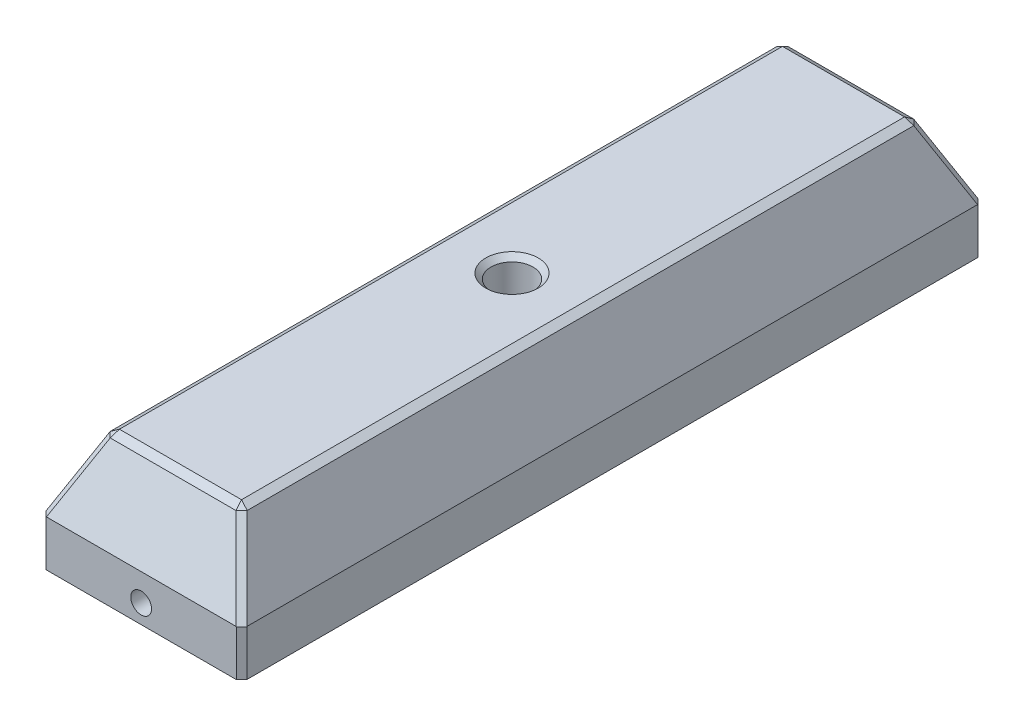
from build123d import *

# Parameters (mm, degrees)
EXTRUDE_1_DEPTH     = 71
CUT_EXTRUDE_1_DEPTH = 75.103710772
SKETCH_3_W          = 18.218739558
SKETCH_3_H          = 4.354088086
EXTRUDE_3_DEPTH     = 15.5
SKETCH_4_R          = 0.995
CUT_EXTRUDE_2_DEPTH = 12
SKETCH_5_W          = 4
SKETCH_5_H          = 3.5
SKETCH_6_R          = 1.5
CUT_EXTRUDE_3_DEPTH = 73.548604312
SKETCH_7_R          = 2.01
CUT_EXTRUDE_4_DEPTH = 5
CHAMFER_2_SIZE      = 0.5


with BuildPart() as part:
    # ｽｹｯﾁ1 → ﾎﾞｽ - 押し出し1 (new body)
    with BuildSketch(Plane.XY):
        Polygon((-6.990630221, 0), (-3.009369779, 0), (-1.990630221, -2.4), (1.990630221, -2.4), (3.009369779, 0), (6.990630221, 0), (8.009369779, -2.4), (9.609369779, -2.4), (9.609369779, 2), (6.345216172, 9), (-6.345216172, 9), (-9.609369779, 2), (-9.609369779, -2.4), (-8.009369779, -2.4), align=None)
    extrude(amount=EXTRUDE_1_DEPTH)

    # ｽｹｯﾁ2 → ｶｯﾄ - 押し出し1 (cut, through all)
    with BuildSketch(Plane(origin=(9.609369779, 0, 0), x_dir=(0, 0, -1), z_dir=(1, 0, 0))):
        Polygon((-71, 2), (-67.735846393, 9), (-71, 9), align=None)
        Polygon((-3.264153607, 9), (0, 9), (0, 2), align=None)
    extrude(amount=-CUT_EXTRUDE_1_DEPTH, mode=Mode.SUBTRACT)

    # 面取り1
    # the kernel refuses this chamfer: 0.5 mm, written as the material it takes off along each edge
    with BuildSketch(Plane(origin=(-6.138482875, 8.697897404, 3.470886905), x_dir=(0.1959067162203001, 0.5268881046463136, 0.8270486586180973), z_dir=(-0.41632572739388224, 0.8082980746110386, -0.4163257273938792)), Plane(origin=(6.138482875, 8.697897404, 3.470886905), x_dir=(-0.8270486586180952, 0.5268881046463165, 0.19590671622030123), z_dir=(0.4163257273938833, 0.8082980746110385, -0.41632572739387846))) as chamfer_1_piece_1:
        Polygon((-0.400884159, 0.228990916), (0.459173014, 0.228990916), (-0.058288855, -0.457981831), align=None)
    extrude(amount=0.4579583, mode=Mode.SUBTRACT)
    with BuildSketch(Plane(origin=(-6.138482875, 8.697897404, 67.529113095), x_dir=(-0.19590671622031064, -0.5268881046463169, 0.8270486586180926), z_dir=(-0.416325727393884, 0.808298074611038, 0.41632572739387863))) as chamfer_1_piece_2:
        Polygon((-0.459173014, 0.228990916), (0.400884159, 0.228990916), (0.058288855, -0.457981831), align=None)
    extrude(amount=0.4579583, mode=Mode.SUBTRACT)
    with BuildSketch(Plane(origin=(6.138482875, 8.697897404, 67.529113095), x_dir=(-0.8270486586180955, 0.5268881046463167, -0.19590671622029923), z_dir=(0.4163257273938827, 0.8082980746110371, 0.4163257273938819))) as chamfer_1_piece_3:
        Polygon((-0.400884159, -0.228990916), (0.459173014, -0.228990916), (-0.058288855, 0.457981831), align=None)
    extrude(amount=0.4579583, mode=Mode.SUBTRACT)
    with BuildSketch(Plane(origin=(9.609369779, -3.685841494, 71), x_dir=(-0.999621916911297, 0, 0.0274958766105822), z_dir=(0, 1, 0)), Plane(origin=(-9.609369779, 3.285841494, 71), x_dir=(0.999621916911297, 0, 0.0274958766105822), z_dir=(0, -1, 0))) as chamfer_1_piece_4:
        with BuildLine():
            Line((0.514336598, 0), (-0.028273577, -0.513558897))
            Line((-0.028273577, -0.513558897), (-0.038269797, -0.513283938))
            ThreePointArc((-0.038269797, -0.513283938), (-0.017064614, -0.256698915), (-0.009996219, 0.000274959))
            Line((-0.009996219, 0.000274959), (0.000274959, 0.009996219))
            ThreePointArc((0.000274959, 0.009996219), (0.257248832, 0.002927825), (0.514611556, 0.009996219))
            Line((0.514611556, 0.009996219), (0.514336598, 0))
        make_face()
    extrude(amount=6.971682988, mode=Mode.SUBTRACT)
    with BuildSketch(Plane(origin=(-9.609369779, 3.285841494, 0), x_dir=(0.9996219169112968, 0, -0.02749587661058639), z_dir=(0, -1, 0)), Plane(origin=(9.609369779, -3.685841494, 0), x_dir=(-0.9996219169112968, 0, -0.02749587661058639), z_dir=(0, 1, 0))) as chamfer_1_piece_5:
        with BuildLine():
            Line((0.514336598, 0), (-0.028273577, 0.513558897))
            Line((-0.028273577, 0.513558897), (-0.038269797, 0.513283938))
            ThreePointArc((-0.038269797, 0.513283938), (-0.017064614, 0.256698915), (-0.009996219, -0.000274959))
            Line((-0.009996219, -0.000274959), (0.000274959, -0.009996219))
            ThreePointArc((0.000274959, -0.009996219), (0.257248832, -0.002927825), (0.514611556, -0.009996219))
            Line((0.514611556, -0.009996219), (0.514336598, 0))
        make_face()
    extrude(amount=6.971682988, mode=Mode.SUBTRACT)
    with BuildSketch(Plane(origin=(-6.345216172, 9, 1.971704795), x_dir=(-0.441365564598093, -0.897327386401979, 0), z_dir=(0, 0, 1))) as chamfer_1_piece_6:
        with BuildLine():
            Line((0.516979525, 0), (-0.237770334, 0.459056747))
            Line((-0.237770334, 0.459056747), (-0.246743608, 0.454643091))
            ThreePointArc((-0.246743608, 0.454643091), (-0.123037104, 0.227486173), (-0.008973274, -0.004413656))
            Line((-0.008973274, -0.004413656), (0.000207861, -0.009997839))
            ThreePointArc((0.000207861, -0.009997839), (0.25858594, -0.004626004), (0.517187386, -0.009997839))
            Line((0.517187386, -0.009997839), (0.516979525, 0))
        make_face()
    extrude(amount=67.056590409, mode=Mode.SUBTRACT)
    with BuildSketch(Plane(origin=(6.345216172, 9, 1.971704795), x_dir=(0.441365564598093, -0.897327386401979, 0), z_dir=(0, 0, 1))) as chamfer_1_piece_7:
        with BuildLine():
            Line((0.516979525, 0), (-0.237770334, -0.459056747))
            Line((-0.237770334, -0.459056747), (-0.246743608, -0.454643091))
            ThreePointArc((-0.246743608, -0.454643091), (-0.123037104, -0.227486173), (-0.008973274, 0.004413656))
            Line((-0.008973274, 0.004413656), (0.000207861, 0.009997839))
            ThreePointArc((0.000207861, 0.009997839), (0.25858594, 0.004626004), (0.517187386, 0.009997839))
            Line((0.517187386, 0.009997839), (0.516979525, 0))
        make_face()
    extrude(amount=67.056590409, mode=Mode.SUBTRACT)
    with BuildSketch(Plane(origin=(7.637664984, 9, 67.735846393), x_dir=(0, -0.8973273864019788, 0.441365564598093), z_dir=(-1, 0, 0))) as chamfer_1_piece_8:
        with BuildLine():
            Line((0.516979525, 0), (-0.237770334, -0.459056747))
            Line((-0.237770334, -0.459056747), (-0.246743608, -0.454643091))
            ThreePointArc((-0.246743608, -0.454643091), (-0.123037104, -0.227486173), (-0.008973274, 0.004413656))
            Line((-0.008973274, 0.004413656), (0.000207861, 0.009997839))
            ThreePointArc((0.000207861, 0.009997839), (0.25858594, 0.004626004), (0.517187386, 0.009997839))
            Line((0.517187386, 0.009997839), (0.516979525, 0))
        make_face()
    extrude(amount=15.275329968, mode=Mode.SUBTRACT)
    with BuildSketch(Plane(origin=(5.843517245, 10.075896822, 67.234147465), x_dir=(-0.9208340423276119, -0.34219239318368305, 0.1870000869994816), z_dir=(0.38928162063502697, -0.8348171294789895, 0.3892816206350193)), Plane(origin=(-10.111068707, 0.924103178, 71.501698928), x_dir=(0.9208340423276127, -0.3421923931836955, 0.1870000869994551), z_dir=(0.3892816206350268, 0.8348171294789896, -0.38928162063501937))) as chamfer_1_piece_9:
        with BuildLine():
            Line((0.515512576, 0), (-0.117174183, 0.502019349))
            Line((-0.117174183, 0.502019349), (-0.126965941, 0.499989208))
            ThreePointArc((-0.126965941, 0.499989208), (-0.062103739, 0.250280562), (-0.009791758, -0.002030141))
            Line((-0.009791758, -0.002030141), (0.000248629, -0.009996909))
            ThreePointArc((0.000248629, -0.009996909), (0.257845581, -0.003590326), (0.515761205, -0.009996909))
            Line((0.515761205, -0.009996909), (0.515512576, 0))
        make_face()
    extrude(amount=10.962632798, mode=Mode.SUBTRACT)
    with BuildSketch(Plane(origin=(5.843517245, 10.075896822, 3.765852535), x_dir=(-0.9208340423276121, -0.3421923931836904, -0.18700008699946713), z_dir=(0.3892816206350273, -0.8348171294789902, -0.38928162063501737)), Plane(origin=(-10.111068707, 0.924103178, -0.501698928), x_dir=(0.9208340423276121, -0.3421923931836903, -0.18700008699946674), z_dir=(0.38928162063502714, 0.8348171294789903, 0.38928162063501737))) as chamfer_1_piece_10:
        with BuildLine():
            Line((0.515512576, 0), (-0.117174183, -0.502019349))
            Line((-0.117174183, -0.502019349), (-0.126965941, -0.499989208))
            ThreePointArc((-0.126965941, -0.499989208), (-0.062103739, -0.250280562), (-0.009791758, 0.002030141))
            Line((-0.009791758, 0.002030141), (0.000248629, 0.009996909))
            ThreePointArc((0.000248629, 0.009996909), (0.257845581, 0.003590326), (0.515761205, 0.009996909))
            Line((0.515761205, 0.009996909), (0.515512576, 0))
        make_face()
    extrude(amount=10.962632798, mode=Mode.SUBTRACT)
    with BuildSketch(Plane(origin=(7.637664984, 9, 3.264153607), x_dir=(0, -0.8973273864019832, -0.4413655645980848), z_dir=(-1, 0, 0))) as chamfer_1_piece_11:
        with BuildLine():
            Line((0.516979525, 0), (-0.237770334, 0.459056747))
            Line((-0.237770334, 0.459056747), (-0.246743608, 0.454643091))
            ThreePointArc((-0.246743608, 0.454643091), (-0.123037104, 0.227486173), (-0.008973274, -0.004413656))
            Line((-0.008973274, -0.004413656), (0.000207861, -0.009997839))
            ThreePointArc((0.000207861, -0.009997839), (0.25858594, -0.004626004), (0.517187386, -0.009997839))
            Line((0.517187386, -0.009997839), (0.516979525, 0))
        make_face()
    extrude(amount=15.275329968, mode=Mode.SUBTRACT)

    # ｽｹｯﾁ3 → ﾎﾞｽ - 押し出し3 (add)
    with BuildSketch(Plane.XY.offset(71)):
        with Locations((0, -0.222955957)):
            Rectangle(SKETCH_3_W, SKETCH_3_H)
    extrude_3 = extrude(amount=-EXTRUDE_3_DEPTH)

    # ｽｹｯﾁ4 → ｶｯﾄ - 押し出し2 (cut)
    with BuildSketch(Plane.XY.offset(71)):
        with Locations((0, -0.6)):
            Circle(SKETCH_4_R)
    cut_extrude_2 = extrude(amount=-CUT_EXTRUDE_2_DEPTH, mode=Mode.SUBTRACT)

    # ﾐﾗｰ1: ﾎﾞｽ - 押し出し3, ｶｯﾄ - 押し出し2 across plane
    add(extrude_3.mirror(Plane(origin=(0, 0, 35.5), x_dir=(1, 0, 0), z_dir=(0, 0, -1))))
    add(cut_extrude_2.mirror(Plane(origin=(0, 0, 35.5), x_dir=(1, 0, 0), z_dir=(0, 0, -1))), mode=Mode.SUBTRACT)

    # ｽｹｯﾁ5 → ｶｯﾄ - 回転1 (revolve, cut)
    with BuildSketch(Plane(origin=(0, -0.6, 0), x_dir=(1, 0, 0), z_dir=(0, 1, 0))):
        with Locations((2, -62.5)):
            Rectangle(SKETCH_5_W, SKETCH_5_H)
        with Locations((2, -8.5)):
            Rectangle(SKETCH_5_W, SKETCH_5_H)
    revolve(axis=Axis((0, -0.6, 59), (0, 0, 1)), mode=Mode.SUBTRACT)

    # ｽｹｯﾁ6 → ｶｯﾄ - 押し出し3 (cut, through all)
    with BuildSketch(Plane.XZ.offset(2.4)):
        with Locations(Location((0, 35.5, 0), (0, 0, 270))):
            Circle(SKETCH_6_R)
    extrude(amount=-CUT_EXTRUDE_3_DEPTH, mode=Mode.SUBTRACT)

    # ｽｹｯﾁ7 → ｶｯﾄ - 押し出し4 (cut)
    with BuildSketch(Plane(origin=(0, 9, 0), x_dir=(1, 0, 0), z_dir=(0, 1, 0))):
        with Locations(Location((0, -35.5, 0), (0, 0, 180))):
            Circle(SKETCH_7_R)
    extrude(amount=-CUT_EXTRUDE_4_DEPTH, mode=Mode.SUBTRACT)

    # 面取り2
    chamfer_2_edges = [part.edges().sort_by_distance(p)[0] for p in [
        (2.01, 9, 35.5),
    ]]
    chamfer(chamfer_2_edges, length=CHAMFER_2_SIZE)


solid = part.part
